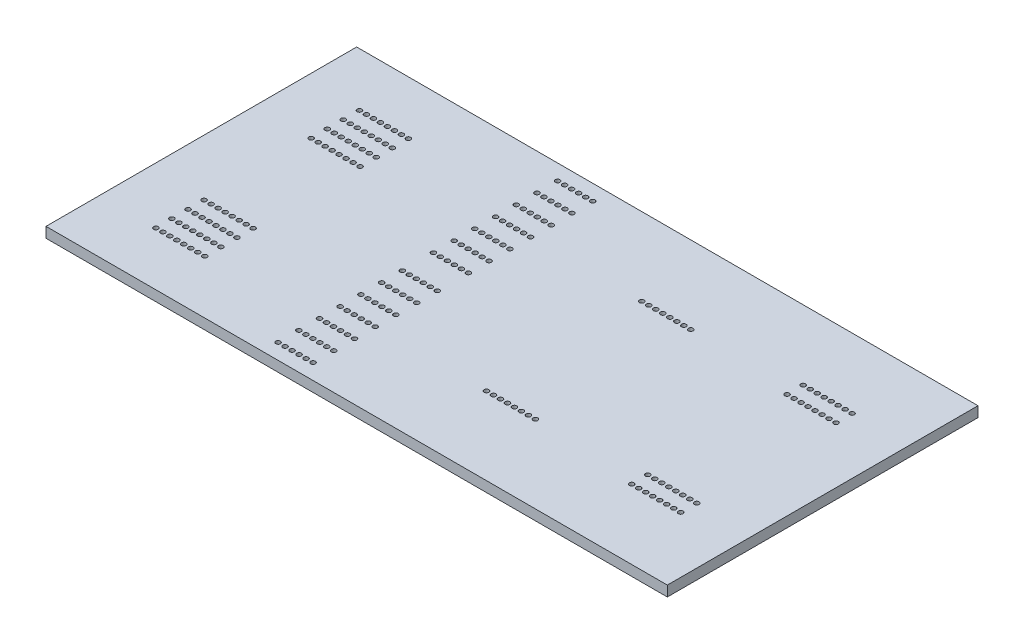
from build123d import *

# Parameters (mm, degrees)
ESQUISSE2_W                     = 120
ESQUISSE2_H                     = 30
BOSS_EXTRU_1_DEPTH              = 2
ENL_V_MAT_EXTRU_3_REACH         = 63.879
ESQUISSE8_R                     = 0.45
R_P_TITION_LIN_AIRE4_COUNT      = 8
R_P_TITION_LIN_AIRE4_PITCH      = 1.35
R_P_TITION_LIN_AIRE4_COUNT_DIR2 = 4
R_P_TITION_LIN_AIRE4_PITCH_DIR2 = 3.111
ENL_V_MAT_EXTRU_4_REACH         = 63.879
ESQUISSE10_R                    = 0.45
R_P_TITION_LIN_AIRE5_COUNT      = 6
R_P_TITION_LIN_AIRE5_PITCH      = 1.35
R_P_TITION_LIN_AIRE5_COUNT_DIR2 = 7
R_P_TITION_LIN_AIRE5_PITCH_DIR2 = 4
ENL_V_MAT_EXTRU_5_REACH         = 63.879
ESQUISSE12_R                    = 0.45
R_P_TITION_LIN_AIRE6_COUNT      = 8
R_P_TITION_LIN_AIRE6_PITCH      = 1.35
ENL_V_MAT_EXTRU_6_REACH         = 63.879
ESQUISSE14_R                    = 0.45
R_P_TITION_LIN_AIRE7_COUNT      = 8
R_P_TITION_LIN_AIRE7_PITCH      = 1.35
R_P_TITION_LIN_AIRE7_COUNT_DIR2 = 2
R_P_TITION_LIN_AIRE7_PITCH_DIR2 = 3.11


with BuildPart() as part:
    # Esquisse2 → Boss.-Extru.1 (new body)
    with BuildSketch(Plane(origin=(0, 0, 0), x_dir=(1, 0, 0), z_dir=(0, 1, 0))):
        Rectangle(ESQUISSE2_W, ESQUISSE2_H)
    extrude(amount=BOSS_EXTRU_1_DEPTH)

    # Esquisse8 → Enlèv. mat.-Extru.3 (cut, up to next)
    with BuildSketch(Plane(origin=(0, 2, 0), x_dir=(1, 0, 0), z_dir=(0, 1, 0)), mode=Mode.PRIVATE) as enl_v_mat_extru_3_sk1:
        with Locations((-49.125, 4.6665)):
            Circle(ESQUISSE8_R)
    enl_v_mat_extru_3_tool1 = extrude(enl_v_mat_extru_3_sk1.sketch, amount=-ENL_V_MAT_EXTRU_3_REACH, mode=Mode.PRIVATE) & part.part
    enl_v_mat_extru_3 = enl_v_mat_extru_3_tool1.solids().sort_by_distance((-49.125, 2, -4.6665))[0]
    add(enl_v_mat_extru_3, mode=Mode.SUBTRACT)

    # Répétition linéaire4: Enl_v. mat.-Extru.3 8 × 4
    with Locations(*[(i * R_P_TITION_LIN_AIRE4_PITCH, 0, j * R_P_TITION_LIN_AIRE4_PITCH_DIR2) for i in range(R_P_TITION_LIN_AIRE4_COUNT) for j in range(R_P_TITION_LIN_AIRE4_COUNT_DIR2) if (i, j) != (0, 0)]):
        add(enl_v_mat_extru_3, mode=Mode.SUBTRACT)

    # Esquisse10 → Enlèv. mat.-Extru.4 (cut, up to next)
    with BuildSketch(Plane(origin=(0, 2, 0), x_dir=(1, 0, 0), z_dir=(0, 1, 0)), mode=Mode.PRIVATE) as enl_v_mat_extru_4_sk1:
        with Locations((-18.175, 12)):
            Circle(ESQUISSE10_R)
    enl_v_mat_extru_4_tool1 = extrude(enl_v_mat_extru_4_sk1.sketch, amount=-ENL_V_MAT_EXTRU_4_REACH, mode=Mode.PRIVATE) & part.part
    enl_v_mat_extru_4 = enl_v_mat_extru_4_tool1.solids().sort_by_distance((-18.175, 2, -12))[0]
    add(enl_v_mat_extru_4, mode=Mode.SUBTRACT)

    # Répétition linéaire5: Enl_v. mat.-Extru.4 6 × 7
    with Locations(*[(i * R_P_TITION_LIN_AIRE5_PITCH, 0, j * R_P_TITION_LIN_AIRE5_PITCH_DIR2) for i in range(R_P_TITION_LIN_AIRE5_COUNT) for j in range(R_P_TITION_LIN_AIRE5_COUNT_DIR2) if (i, j) != (0, 0)]):
        add(enl_v_mat_extru_4, mode=Mode.SUBTRACT)

    # Esquisse12 → Enlèv. mat.-Extru.5 (cut, up to next)
    with BuildSketch(Plane(origin=(0, 2, 0), x_dir=(1, 0, 0), z_dir=(0, 1, 0)), mode=Mode.PRIVATE) as enl_v_mat_extru_5_sk1:
        with Locations((10.075, 0)):
            Circle(ESQUISSE12_R)
    enl_v_mat_extru_5_tool1 = extrude(enl_v_mat_extru_5_sk1.sketch, amount=-ENL_V_MAT_EXTRU_5_REACH, mode=Mode.PRIVATE) & part.part
    enl_v_mat_extru_5 = enl_v_mat_extru_5_tool1.solids().sort_by_distance((10.075, 2, 0))[0]
    add(enl_v_mat_extru_5, mode=Mode.SUBTRACT)

    # Répétition linéaire6: Enlèv. mat.-Extru.5 ×8
    with Locations(*[(i * R_P_TITION_LIN_AIRE6_PITCH, 0, 0) for i in range(1, R_P_TITION_LIN_AIRE6_COUNT)]):
        add(enl_v_mat_extru_5, mode=Mode.SUBTRACT)

    # Esquisse14 → Enlèv. mat.-Extru.6 (cut, up to next)
    with BuildSketch(Plane(origin=(0, 2, 0), x_dir=(1, 0, 0), z_dir=(0, 1, 0)), mode=Mode.PRIVATE) as enl_v_mat_extru_6_sk1:
        with Locations((39.675, 1.555)):
            Circle(ESQUISSE14_R)
    enl_v_mat_extru_6_tool1 = extrude(enl_v_mat_extru_6_sk1.sketch, amount=-ENL_V_MAT_EXTRU_6_REACH, mode=Mode.PRIVATE) & part.part
    enl_v_mat_extru_6 = enl_v_mat_extru_6_tool1.solids().sort_by_distance((39.675, 2, -1.555))[0]
    add(enl_v_mat_extru_6, mode=Mode.SUBTRACT)

    # Répétition linéaire7: Enl_v. mat.-Extru.6 8 × 2
    with Locations(*[(i * R_P_TITION_LIN_AIRE7_PITCH, 0, j * R_P_TITION_LIN_AIRE7_PITCH_DIR2) for i in range(R_P_TITION_LIN_AIRE7_COUNT) for j in range(R_P_TITION_LIN_AIRE7_COUNT_DIR2) if (i, j) != (0, 0)]):
        add(enl_v_mat_extru_6, mode=Mode.SUBTRACT)

    # Symétrie1: part across plane


with BuildPart() as part_1:
    add(part.part)
    add(part.part.mirror(Plane(origin=(-60, 2, 15), x_dir=(1, 0, 0), z_dir=(0, 0, -1))))


solid = part_1.part
